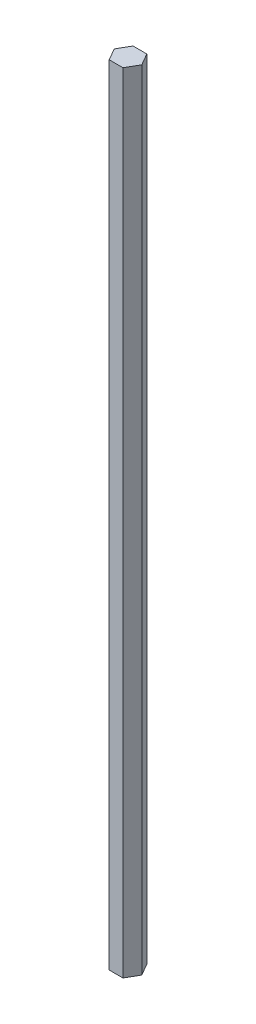
from build123d import *

# Parameters (mm, degrees)
BOSS_EXTRUDE1_DEPTH = 210


with BuildPart() as part:
    # Sketch1 → Boss-Extrude1 (new, symmetric)
    with BuildSketch(Plane(origin=(0, 0, 0), x_dir=(1, 0, 0), z_dir=(0, 1, 0))):
        Polygon((7.332348419, 0), (3.666174209, 6.35), (-3.666174209, 6.35), (-7.332348419, 0), (-3.666174209, -6.35), (3.666174209, -6.35), align=None)
    extrude(amount=BOSS_EXTRUDE1_DEPTH, both=True)


solid = part.part
